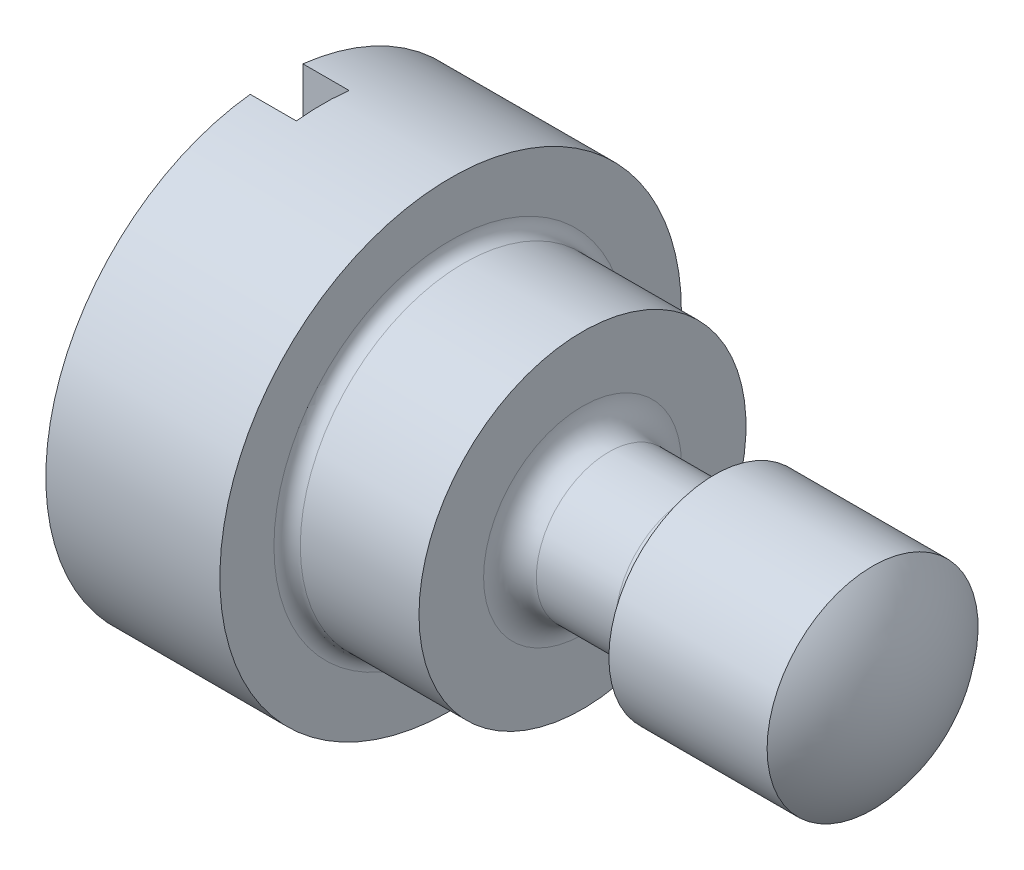
from build123d import *

# Parameters (mm, degrees)
SKETCH1_R       = 1.75
BASEHEAD_DEPTH  = 1.32
SLOT_DEPTH      = 3.848514667
SLOT_DEPTH_BACK = 3.848514667
SKETCH2_W       = 0.4
SKETCH2_H       = 0.35
FILLET1_R       = 0.1


with BuildPart() as part:
    # Sketch1 → BaseHead (new body)
    with BuildSketch(Plane(origin=(0, 0, 0), x_dir=(0, 0, -1), z_dir=(1, 0, 0))):
        Circle(SKETCH1_R)
    extrude(amount=BASEHEAD_DEPTH)

    # Sketch2 → Slot (cut, two sides: drawn at the far end of the back side and taken through both)
    with BuildSketch(Plane(origin=(0.19675588, 0, 0.19675588), x_dir=(0, 0, 1), z_dir=(0, 1, 0)).offset(-SLOT_DEPTH_BACK)):
        with Locations((-0.19675588, -0.02175588)):
            Rectangle(SKETCH2_W, SKETCH2_H)
    extrude(amount=SLOT_DEPTH + SLOT_DEPTH_BACK, mode=Mode.SUBTRACT)

    # Sketch4 → BaseBody (revolve)
    with BuildSketch(Plane.XY):
        with BuildLine():
            Line((1.32, 1.24), (2.32, 1.24))
            Line((2.32, 1.24), (2.32, 0.75))
            ThreePointArc((2.32, 0.75), (2.378578644, 0.608578644), (2.52, 0.55))
            Line((2.52, 0.55), (3.12, 0.55))
            ThreePointArc((3.12, 0.55), (3.261421356, 0.608578644), (3.32, 0.75))
            Line((3.32, 0.75), (3.32, 0.8))
            Line((3.32, 0.8), (4.52, 0.8))
            ThreePointArc((4.52, 0.8), (4.742533833, 0.427200187), (4.82, 0))
            Line((4.82, 0), (1.32, 0))
            Line((1.32, 0), (1.32, 1.24))
        make_face()
    revolve(axis=Axis((-0.659514622, 0, 0), (1, 0, 0)))

    # Fillet1
    fillet1_edges = [part.edges().sort_by_distance(p)[0] for p in [
        (1.32, -1.24, 0),
    ]]
    fillet(fillet1_edges, radius=FILLET1_R)


solid = part.part
